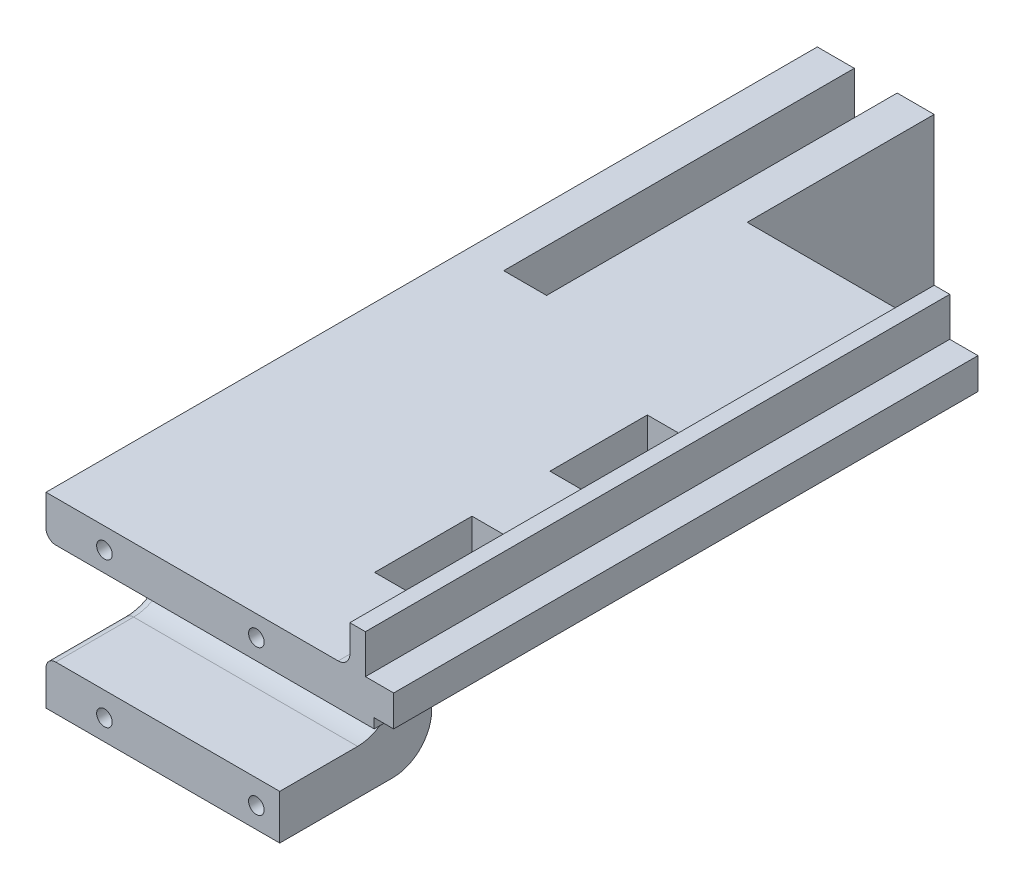
from build123d import *

# Parameters (mm, degrees)
CROQUIS1_W                 = 60
CROQUIS1_H                 = 48
SALIENTE_EXTRUIR1_DEPTH    = 6
CROQUIS4_W                 = 60
CROQUIS4_H                 = 11.5
SALIENTE_EXTRUIR3_DEPTH    = 30
CROQUIS5_R                 = 2
CORTAR_EXTRUIR3_DEPTH      = 16
CROQUIS6_W                 = 30
CROQUIS6_H                 = 48
SALIENTE_EXTRUIR4_DEPTH    = 162
CROQUIS7_R                 = 2
CORTAR_EXTRUIR4_DEPTH      = 16
CROQUIS11_W                = 150
CROQUIS11_H                = 11.5
SALIENTE_EXTRUIR6_DEPTH    = 59.25
CROQUIS12_W                = 4
CROQUIS12_H                = 150
SALIENTE_EXTRUIR7_DEPTH    = 10
CORTAR_EXTRUIR6_DEPTH      = 170.016303475
CORTAR_EXTRUIR6_DEPTH_BACK = 170.016303475
CROQUIS14_W                = 5
CROQUIS14_H                = 3.5
CORTAR_EXTRUIR7_DEPTH      = 213.768679181
CORTAR_EXTRUIR7_DEPTH_BACK = 90
CROQUIS15_W                = 11
CROQUIS15_H                = 11
CROQUIS16_W                = 30
CROQUIS16_H                = 1
CORTAR_EXTRUIR10_DEPTH     = 190.450484429
REDONDEO1_R                = 10
CROQUIS20_W                = 30
CROQUIS20_H                = 36.5
SALIENTE_EXTRUIR8_DEPTH    = 50
CROQUIS21_W                = 9
CROQUIS21_H                = 25
CORTAR_EXTRUIR11_DEPTH     = 40
CROQUIS22_W                = 30
CROQUIS22_H                = 36.5
CORTAR_EXTRUIR13_DEPTH     = 47
REDONDEO3_R                = 10
CROQUIS23_R                = 2
CORTAR_EXTRUIR14_DEPTH     = 16
REDONDEO4_R                = 3
CORTAR_EXTRUIR15_DEPTH     = 170
REDONDEO5_R                = 6
REDONDEO6_R                = 2.5


with BuildPart() as part:
    # Croquis1 → Saliente-Extruir1 (new body)
    with BuildSketch(Plane.XY):
        with Locations((-36.216216216, 7.011261261)):
            Rectangle(CROQUIS1_W, CROQUIS1_H)
    extrude(amount=SALIENTE_EXTRUIR1_DEPTH)

    # Croquis4 → Saliente-Extruir3 (add)
    with BuildSketch(Plane.XY.offset(6)):
        with Locations((-36.216216216, 25.261261261)):
            Rectangle(CROQUIS4_W, CROQUIS4_H)
        with Locations((-36.216216216, -11.238738739)):
            Rectangle(CROQUIS4_W, CROQUIS4_H)
    extrude(amount=SALIENTE_EXTRUIR3_DEPTH)

    # Croquis5 → Cortar-Extruir3 (cut)
    with BuildSketch(Plane.XY.offset(36)):
        with Locations((-51.216216216, 25.661261261)):
            Circle(CROQUIS5_R)
        with Locations((-12.216216216, 25.661261261)):
            Circle(CROQUIS5_R)
        with Locations((-12.216216216, -11.638738739)):
            Circle(CROQUIS5_R)
        with Locations((-51.216216216, -11.638738739)):
            Circle(CROQUIS5_R)
    extrude(amount=-CORTAR_EXTRUIR3_DEPTH, mode=Mode.SUBTRACT)

    # Croquis6 → Saliente-Extruir4 (add)
    with BuildSketch(Plane(origin=(0, 0, 0), x_dir=(-1, 0, 0), z_dir=(0, 0, -1))):
        with Locations((51.216216216, 7.011261261)):
            Rectangle(CROQUIS6_W, CROQUIS6_H)
    extrude(amount=SALIENTE_EXTRUIR4_DEPTH)

    # Croquis7 → Cortar-Extruir4 (cut)
    with BuildSketch(Plane(origin=(0, 0, -162), x_dir=(-1, 0, 0), z_dir=(0, 0, -1))):
        with Locations((51.216216216, 7.011261261)):
            Circle(CROQUIS7_R)
    extrude(amount=-CORTAR_EXTRUIR4_DEPTH, mode=Mode.SUBTRACT)

    # Croquis11 → Saliente-Extruir6 (add)
    with BuildSketch(Plane(origin=(-36.216216216, 0, 0), x_dir=(0, 0, -1), z_dir=(1, 0, 0))):
        with Locations((39, 25.261261261)):
            Rectangle(CROQUIS11_W, CROQUIS11_H)
    extrude(amount=SALIENTE_EXTRUIR6_DEPTH)

    # Croquis12 → Saliente-Extruir7 (add)
    with BuildSketch(Plane(origin=(0, 31.011261261, 0), x_dir=(1, 0, 0), z_dir=(0, 1, 0))):
        with Locations((13.783783784, 39)):
            Rectangle(CROQUIS12_W, CROQUIS12_H)
    extrude(amount=SALIENTE_EXTRUIR7_DEPTH)

    # Croquis14 → Cortar-Extruir6 (cut, two sides: drawn at the far end of the back side and taken through both)
    with BuildSketch(Plane(origin=(0, 0, -114), x_dir=(-1, 0, 0), z_dir=(0, 0, -1)).offset(-CORTAR_EXTRUIR6_DEPTH_BACK)):
        with Locations((-20.533783784, 21.261261261)):
            Rectangle(CROQUIS14_W, CROQUIS14_H)
    extrude(amount=CORTAR_EXTRUIR6_DEPTH + CORTAR_EXTRUIR6_DEPTH_BACK, mode=Mode.SUBTRACT)

    # Croquis15 → Cortar-Extruir7 (cut, two sides: drawn at the far end of the back side and taken through both)
    with BuildSketch(Plane(origin=(0, 0, -162), x_dir=(-1, 0, 0), z_dir=(0, 0, -1)).offset(-CORTAR_EXTRUIR7_DEPTH_BACK)):
        with Locations((51.216216216, 25.511261261)):
            Rectangle(CROQUIS15_W, CROQUIS15_H)
    extrude(amount=CORTAR_EXTRUIR7_DEPTH + CORTAR_EXTRUIR7_DEPTH_BACK, mode=Mode.SUBTRACT)

    # Croquis16 → Cortar-Extruir10 (cut, through all)
    with BuildSketch(Plane.ZY.offset(66.216216216)):
        with Locations((21, 20.011261261)):
            Rectangle(CROQUIS16_W, CROQUIS16_H)
    extrude(amount=-CORTAR_EXTRUIR10_DEPTH, mode=Mode.SUBTRACT)

    # Redondeo1
    redondeo1_edges = [part.edges().sort_by_distance(p)[0] for p in [
        (-36.216216216, -5.488738739, 6),
        (-24.091216216, 20.511261261, 6),
    ]]
    fillet(redondeo1_edges, radius=REDONDEO1_R)

    # Croquis20 → Saliente-Extruir8 (add)
    with BuildSketch(Plane(origin=(0, 0, 0), x_dir=(-1, 0, 0), z_dir=(0, 0, -1))):
        with Locations((21.216216216, 1.261261261)):
            Rectangle(CROQUIS20_W, CROQUIS20_H)
    extrude(amount=SALIENTE_EXTRUIR8_DEPTH)

    # Croquis21 → Cortar-Extruir11 (cut)
    with BuildSketch(Plane.XZ.offset(-19.511261261)):
        with Locations((-1.716216216, -0.858898944)):
            Rectangle(CROQUIS21_W, CROQUIS21_H)
        with Locations((-1.716216216, -45.858898944)):
            Rectangle(CROQUIS21_W, CROQUIS21_H)
    extrude(amount=-CORTAR_EXTRUIR11_DEPTH, mode=Mode.SUBTRACT)

    # Croquis22 → Cortar-Extruir13 (cut)
    with BuildSketch(Plane(origin=(0, 0, -50), x_dir=(-1, 0, 0), z_dir=(0, 0, -1))):
        with Locations((21.216216216, 1.261261261)):
            Rectangle(CROQUIS22_W, CROQUIS22_H)
    extrude(amount=-CORTAR_EXTRUIR13_DEPTH, mode=Mode.SUBTRACT)

    # Redondeo3
    redondeo3_edges = [part.edges().sort_by_distance(p)[0] for p in [
        (-21.216216216, -16.988738739, -3),
    ]]
    fillet(redondeo3_edges, radius=REDONDEO3_R)

    # Croquis23 → Cortar-Extruir14 (cut)
    with BuildSketch(Plane.XY.offset(36)):
        with Locations((-12.216216216, -11.638738739)):
            Circle(CROQUIS23_R)
        with Locations((-51.216216216, -11.638738739)):
            Circle(CROQUIS23_R)
        with Locations((-12.216216216, 25.661261261)):
            Circle(CROQUIS23_R)
        with Locations((-51.216216216, 25.661261261)):
            Circle(CROQUIS23_R)
    extrude(amount=-CORTAR_EXTRUIR14_DEPTH, mode=Mode.SUBTRACT)

    # Redondeo4
    redondeo4_edges = [part.edges().sort_by_distance(p)[0] for p in [
        (11.783783784, 31.011261261, -39),
    ]]
    fillet(redondeo4_edges, radius=REDONDEO4_R)

    # Croquis24 → Cortar-Extruir15 (cut)
    with BuildSketch(Plane(origin=(0, 0, -162), x_dir=(-1, 0, 0), z_dir=(0, 0, -1))):
        Polygon((48.616216216, -16.988738739), (48.616216216, -12.988738739), (44.216216216, -12.988738739), (44.216216216, -8.988738739), (58.216216216, -8.988738739), (58.216216216, -12.988738739), (53.816216216, -12.988738739), (53.816216216, -16.988738739), align=None)
    extrude(amount=-CORTAR_EXTRUIR15_DEPTH, mode=Mode.SUBTRACT)

    # Redondeo5
    redondeo5_edges = [part.edges().sort_by_distance(p)[0] for p in [
        (-36.216216216, 19.511261261, -58.5),
    ]]
    fillet(redondeo5_edges, radius=REDONDEO5_R)

    # Redondeo6
    redondeo6_edges = [part.edges().sort_by_distance(p)[0] for p in [
        (-66.216216216, 20.511261261, 26),
        (-66.216216216, 17.582329073, 8.928932188),
        (-66.216216216, 7.511261261, 6),
        (-66.216216216, -2.559806551, 8.928932188),
        (-66.216216216, -5.488738739, 26),
    ]]
    fillet(redondeo6_edges, radius=REDONDEO6_R)


solid = part.part
